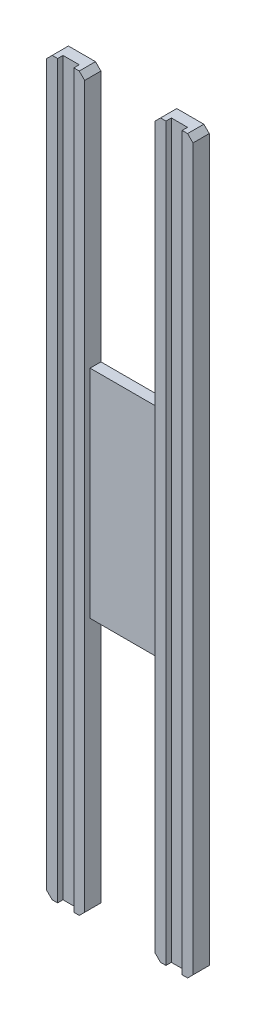
from build123d import *

# Parameters (mm, degrees)
SCHIZZO1_W                   = 6.5
SCHIZZO1_H                   = 40
ESTRUSIONE_ESTRUSIONE1_DEPTH = 2
SCHIZZO2_W                   = 3
SCHIZZO2_H                   = 135
ESTRUSIONE_ESTRUSIONE2_DEPTH = 7
SMUSSO1_SIZE                 = 1
SCHIZZO4_W                   = 3
SCHIZZO4_H                   = 1
TAGLIO_ESTRUSIONE1_DEPTH     = 136.706484738
SMUSSO1_OF_SPECCHIA9_SIZE    = 1


with BuildPart() as part:
    # Schizzo1 → Estrusione-Estrusione1 (new body)
    with BuildSketch(Plane.XY):
        with Locations((3.25, 20)):
            Rectangle(SCHIZZO1_W, SCHIZZO1_H)
    estrusione_estrusione1 = extrude(amount=ESTRUSIONE_ESTRUSIONE1_DEPTH)

    # Schizzo2 → Estrusione-Estrusione2 (add)
    with BuildSketch(Plane(origin=(6.5, 0, 0), x_dir=(0, 0, -1), z_dir=(1, 0, 0))):
        with Locations((-1.5, 20)):
            Rectangle(SCHIZZO2_W, SCHIZZO2_H)
    estrusione_estrusione2 = extrude(amount=ESTRUSIONE_ESTRUSIONE2_DEPTH)

    # Smusso1
    smusso1_edges = [part.edges().sort_by_distance(p)[0] for p in [
        (6.5, -47.5, 1.5),
        (13.5, -47.5, 1.5),
        (6.5, 87.5, 1.5),
        (13.5, 87.5, 1.5),
    ]]
    chamfer(smusso1_edges, length=SMUSSO1_SIZE)

    # Schizzo4 → Taglio-Estrusione1 (cut, through all)
    with BuildSketch(Plane.XZ.offset(47.5)):
        with Locations((10, 2.5)):
            Rectangle(SCHIZZO4_W, SCHIZZO4_H)
    taglio_estrusione1 = extrude(amount=-TAGLIO_ESTRUSIONE1_DEPTH, mode=Mode.SUBTRACT)

    # Specchia9: Estrusione-Estrusione1, Estrusione-Estrusione2, Taglio-Estrusione1 across plane
    add(estrusione_estrusione1.mirror(Plane.ZY))
    add(estrusione_estrusione2.mirror(Plane.ZY))
    add(taglio_estrusione1.mirror(Plane.ZY), mode=Mode.SUBTRACT)

    # Smusso1 of Specchia9
    smusso1_of_specchia9_edges = [part.edges().sort_by_distance(p)[0] for p in [
        (-6.5, -47.5, 1.5),
        (-13.5, -47.5, 1.5),
        (-6.5, 87.5, 1.5),
        (-13.5, 87.5, 1.5),
    ]]
    chamfer(smusso1_of_specchia9_edges, length=SMUSSO1_OF_SPECCHIA9_SIZE)


solid = part.part
